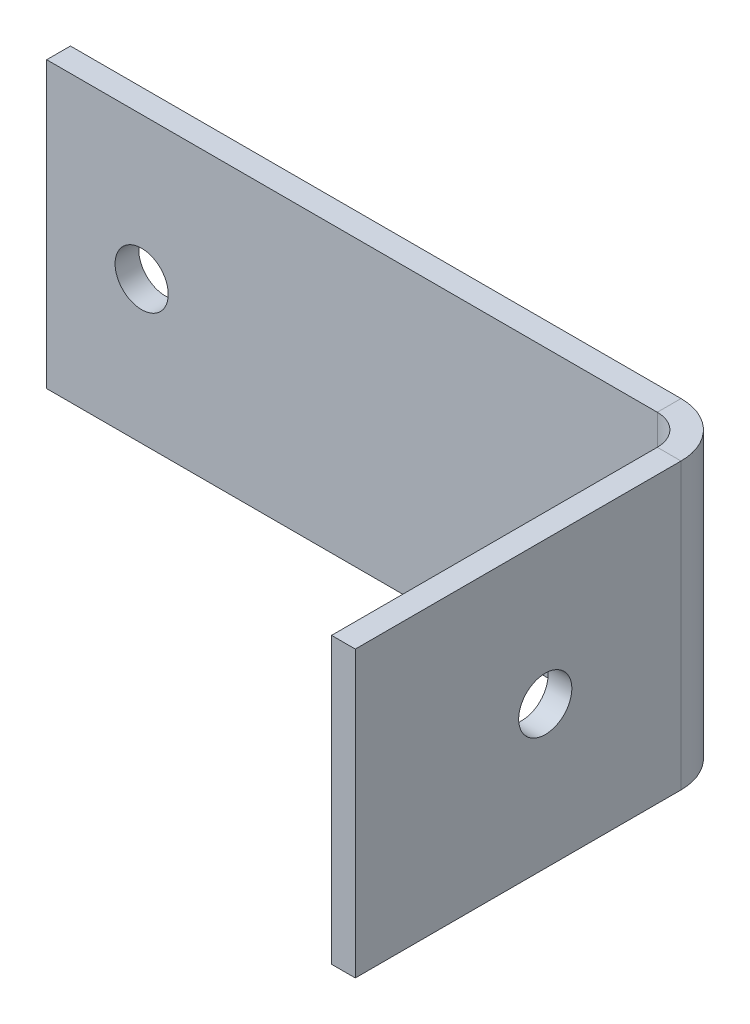
from build123d import *

# Parameters (mm, degrees)
SKETCH1_W                    = 88.9
SKETCH1_H                    = 38.1
SKETCH1_R                    = 3.556
BASE_FLANGE1_DEPTH           = 3.175
EDGE_FLANGE1_STRIP_W         = 20.82
EDGE_FLANGE1_STRIP_H         = 3.175
EDGE_FLANGE1_STRIP_CUT_DEPTH = 38.1
EDGE_FLANGE1_DEPTH           = 38.1
SKETCH9_R                    = 3.556
CUT_EXTRUDE1_DEPTH           = 147.910238326


# Sheet-metal steps are written as plain solids
with BuildPart() as part:
    # Sketch1 → Base-Flange1 (new body)
    with BuildSketch(Plane.XY):
        with Locations((-57.15, 88.9)):
            Rectangle(SKETCH1_W, SKETCH1_H)
        with Locations((-88.9, 88.9)):
            Circle(SKETCH1_R, mode=Mode.SUBTRACT)
    extrude(amount=BASE_FLANGE1_DEPTH)

    # Edge-Flange1 strip (across the edge) → Edge-Flange1 strip cut (cut)
    with BuildSketch(Plane(origin=(-12.7, 69.85, 3.175), x_dir=(-1, 0, 0), z_dir=(0, 1, 0))):
        with Locations((-3.175, -1.5875)):
            Rectangle(EDGE_FLANGE1_STRIP_W, EDGE_FLANGE1_STRIP_H)
    extrude(amount=EDGE_FLANGE1_STRIP_CUT_DEPTH, mode=Mode.SUBTRACT)

    # Edge-Flange1 section (across the edge) → Edge-Flange1 (add)
    with BuildSketch(Plane(origin=(-12.7, 69.85, 3.175), x_dir=(-1, 0, 0), z_dir=(0, 1, 0))):
        with BuildLine():
            Line((0, 4.06), (0, 47.625))
            Line((0, 47.625), (3.175, 47.625))
            Line((3.175, 47.625), (3.175, 4.06))
            ThreePointArc((3.175, 4.06), (4.364146468, 1.189146468), (7.235, 0))
            Line((7.235, 0), (7.235, -3.175))
            ThreePointArc((7.235, -3.175), (2.119082438, -1.055917562), (0, 4.06))
        make_face()
    extrude(amount=EDGE_FLANGE1_DEPTH)

    # Sketch9 → Cut-Extrude1 (cut, through all)
    with BuildSketch(Plane.ZY.offset(15.875)):
        with Locations((25.4, 88.9)):
            Circle(SKETCH9_R)
    extrude(amount=-CUT_EXTRUDE1_DEPTH, mode=Mode.SUBTRACT)


solid = part.part
